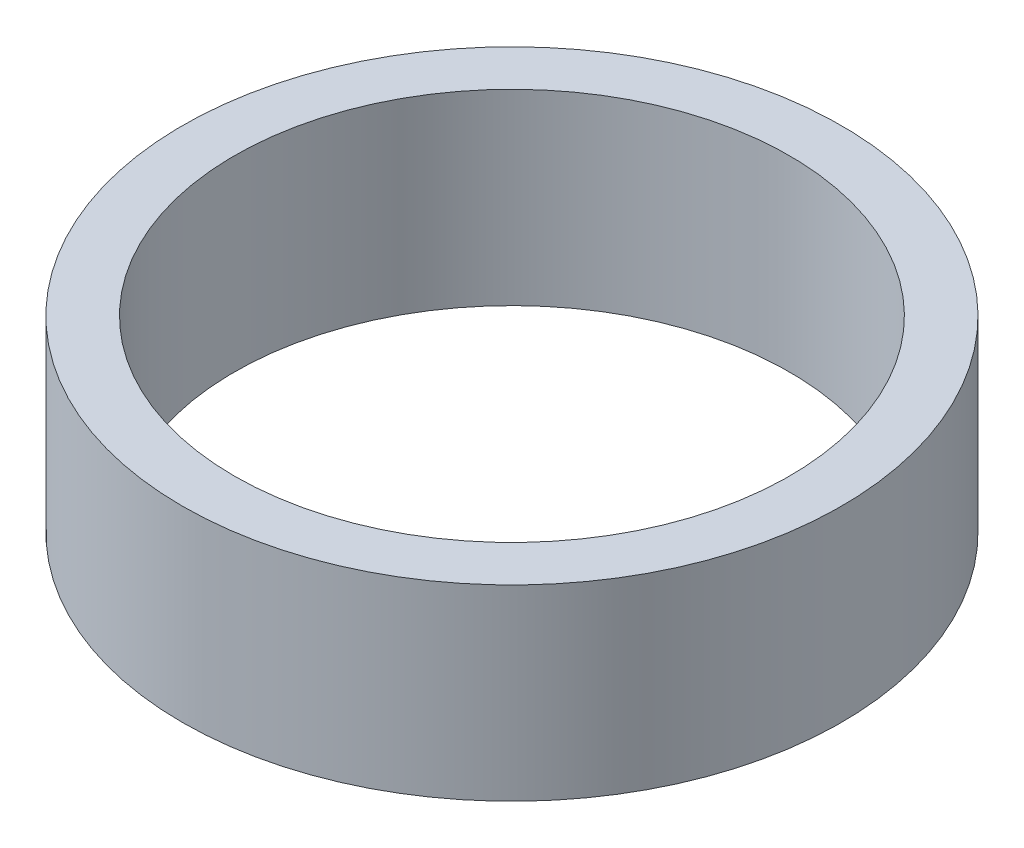
from build123d import *

# Parameters (mm, degrees)
SKETCH1_R           = 47.5
BOSS_EXTRUDE1_DEPTH = 27
SKETCH2_R           = 40
CUT_EXTRUDE1_DEPTH  = 73.398204398


with BuildPart() as part:
    # Sketch1 → Boss-Extrude1 (new body)
    with BuildSketch(Plane(origin=(0, 0, 0), x_dir=(1, 0, 0), z_dir=(0, 1, 0))):
        Circle(SKETCH1_R)
    extrude(amount=BOSS_EXTRUDE1_DEPTH)

    # Sketch2 → Cut-Extrude1 (cut, through all)
    with BuildSketch(Plane(origin=(0, 0, 0), x_dir=(1, 0, 0), z_dir=(0, 1, 0))):
        Circle(SKETCH2_R)
    extrude(amount=CUT_EXTRUDE1_DEPTH, mode=Mode.SUBTRACT)


solid = part.part
